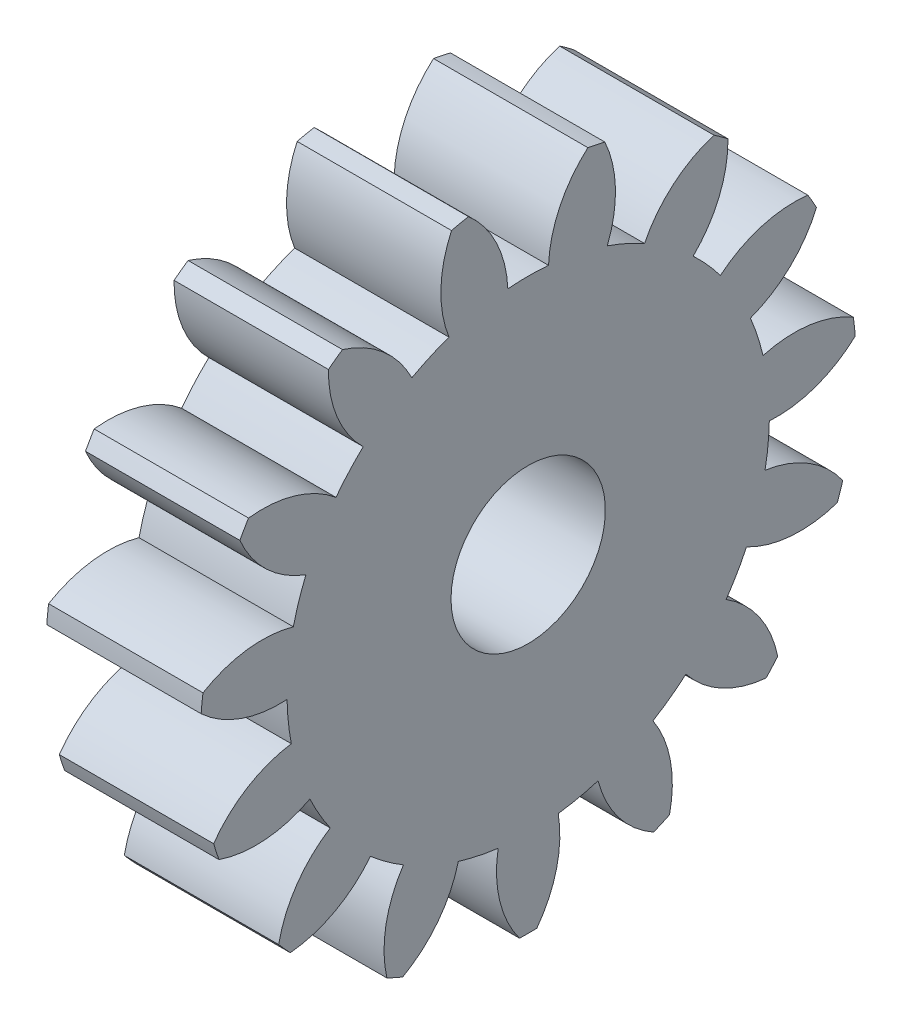
from build123d import *

# Parameters (mm, degrees)
BASPROSKE_W     = 6
BASPROSKE_H     = 12.75
TOOTHCUT_DEPTH  = 20.003289189
TEETHCUTS_COUNT = 15
TEETHCUTS_ANGLE = 336
BORSKE_R        = 3
BORE_DEPTH      = 50.0000508


with BuildPart() as part:
    # BasProSke → Base-Revolve (revolve)
    with BuildSketch(Plane(origin=(0, 0, 0), x_dir=(1, 0, 0), z_dir=(0, 1, 0))):
        with Locations((3, 6.375)):
            Rectangle(BASPROSKE_W, BASPROSKE_H)
    revolve(axis=Axis((-10, 0, 0), (1, 0, 0)))

    # TooCutSke → ToothCut (cut, through all)
    with BuildSketch(Plane(origin=(0, 0, 0), x_dir=(0, 0, -1), z_dir=(1, 0, 0))):
        with BuildLine():
            ThreePointArc((0.791546546, 9.340520867), (0, 9.374), (-0.791546546, 9.340520867))
            ThreePointArc((-0.791546546, 9.340520867), (-1.235070734, 11.110218102), (-2.344732916, 12.558386549))
            ThreePointArc((-2.344732916, 12.558386549), (0, 12.7754), (2.344732916, 12.558386549))
            ThreePointArc((2.344732916, 12.558386549), (1.235070734, 11.110218102), (0.791546546, 9.340520867))
        make_face()
    toothcut = extrude(amount=TOOTHCUT_DEPTH, mode=Mode.SUBTRACT)

    # TeethCuts: ToothCut ×15 about axis
    teethcuts_axis = Axis((-10, 0, 0), (1, 0, 0))
    for i in range(1, TEETHCUTS_COUNT):
        add(toothcut.rotate(teethcuts_axis, i * TEETHCUTS_ANGLE / (TEETHCUTS_COUNT - 1)), mode=Mode.SUBTRACT)

    # BorSke → Bore (cut, symmetric)
    with BuildSketch(Plane(origin=(0, 0, 0), x_dir=(0, 0, -1), z_dir=(1, 0, 0))):
        Circle(BORSKE_R)
    extrude(amount=BORE_DEPTH, both=True, mode=Mode.SUBTRACT)


solid = part.part
